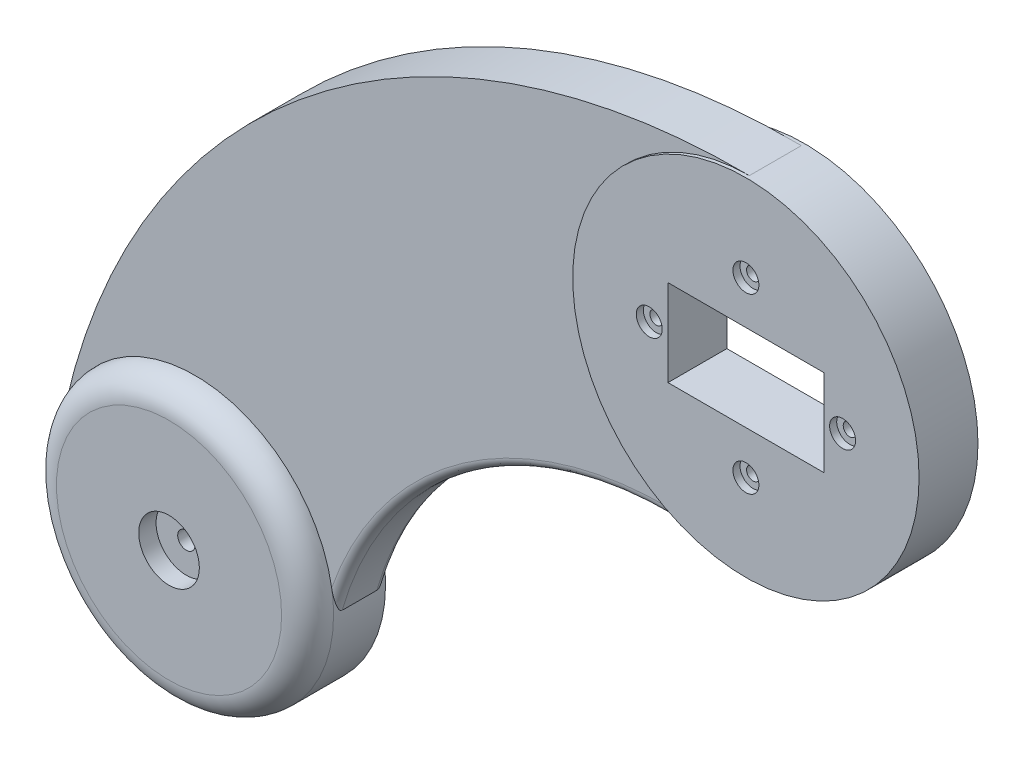
from build123d import *

# Parameters (mm, degrees)
BOSS_EXTRUDE3_DEPTH                                 = 3.81
BOSS_EXTRUDE4_DEPTH                                 = 7.62
BOSS_EXTRUDE4_DEPTH_BACK                            = 3.81
SKETCH1_6_R                                         = 20.32
SKETCH1_7_R                                         = 25.4
BOSS_EXTRUDE5_DEPTH                                 = 4.318
SKETCH3_R                                           = 1.27
CUT_EXTRUDE1_DEPTH                                  = 11.43
SKETCH4_R                                           = 4.445
CUT_EXTRUDE2_DEPTH                                  = 2.54
FILLET1_R                                           = 3.81
SKETCH5_R                                           = 19.05
CUT_EXTRUDE3_DEPTH                                  = 6.35
SKETCH6_W                                           = 22.86
SKETCH6_H                                           = 12.7
CUT_EXTRUDE4_DEPTH                                  = 138.528436683
FILLET8_R                                           = 1.27
FILLET9_R                                           = 1.27
CBORE_FOR_1_BINDING_HEAD_MACHINE_SCREW3_D           = 1.89992
CBORE_FOR_1_BINDING_HEAD_MACHINE_SCREW3_DEPTH       = 5.017206446
CBORE_FOR_1_BINDING_HEAD_MACHINE_SCREW3_CBORE_D     = 3.81
CBORE_FOR_1_BINDING_HEAD_MACHINE_SCREW3_CBORE_DEPTH = 1.0414
CBORE_FOR_1_BINDING_HEAD_MACHINE_SCREW3_TIP         = 0.570793554
BOSS_EXTRUDE6_START                                 = 2.54
SKETCH17_R                                          = 19.05
BOSS_EXTRUDE6_DEPTH                                 = 2.54


# Read off the part's stored shape, not the designer's step: CBORE for #1 Binding Head Machine Screw4
# Some blends are built 0.0001 mm under size
with BuildPart() as part:
    # Sketch1 → Boss-Extrude3 (new, symmetric)
    with BuildSketch(Plane.XY):
        with BuildLine():
            ThreePointArc((-18.897418568, 7.46926847), (3.801766346, 19.961186654), (20.32, 0))
            ThreePointArc((20.32, 0), (40.208637995, 27.902434348), (73.290830481, 36.828368704))
            ThreePointArc((73.290830481, 36.828368704), (56.22683941, 64.989379592), (81.300738581, 86.332338755))
            ThreePointArc((81.300738581, 86.332338755), (17.289703956, 64.576407081), (-18.897418568, 7.46926847))
        make_face()
    extrude(amount=BOSS_EXTRUDE3_DEPTH, both=True)

    # Sketch1<6> → Boss-Extrude4 (add, two sides: drawn at the far end of the back side and taken through both)
    with BuildSketch(Plane.XY.offset(-BOSS_EXTRUDE4_DEPTH_BACK)):
        Circle(SKETCH1_6_R)
    extrude(amount=BOSS_EXTRUDE4_DEPTH + BOSS_EXTRUDE4_DEPTH_BACK)

    # Sketch1<7> → Boss-Extrude5 (add, symmetric)
    with BuildSketch(Plane.XY):
        with Locations((81.300738581, 60.932338755)):
            Circle(SKETCH1_7_R)
    extrude(amount=BOSS_EXTRUDE5_DEPTH, both=True)

    # Sketch3 → Cut-Extrude1 (cut)
    with BuildSketch(Plane(origin=(0, 0, -3.81), x_dir=(-1, 0, 0), z_dir=(0, 0, -1))):
        Circle(SKETCH3_R)
    extrude(amount=-CUT_EXTRUDE1_DEPTH, mode=Mode.SUBTRACT)

    # Sketch4 → Cut-Extrude2 (cut)
    with BuildSketch(Plane.XY.offset(7.62)):
        Circle(SKETCH4_R)
    extrude(amount=-CUT_EXTRUDE2_DEPTH, mode=Mode.SUBTRACT)

    # Fillet1
    fillet1_edges = [part.edges().sort_by_distance(p)[0] for p in [
        (-20.32, 0, 7.62),
    ]]
    fillet(fillet1_edges, radius=FILLET1_R - 0.0001)  # a hair under: the kernel refuses the full size

    # Sketch5 → Cut-Extrude3 (cut)
    with BuildSketch(Plane(origin=(0, 0, -3.81), x_dir=(-1, 0, 0), z_dir=(0, 0, -1))):
        Circle(SKETCH5_R)
    extrude(amount=-CUT_EXTRUDE3_DEPTH, mode=Mode.SUBTRACT)

    # Sketch6 → Cut-Extrude4 (cut, through all)
    with BuildSketch(Plane.XY.offset(4.318)):
        with Locations((81.300738581, 60.932338755)):
            Rectangle(SKETCH6_W, SKETCH6_H)
    extrude(amount=-CUT_EXTRUDE4_DEPTH, mode=Mode.SUBTRACT)

    # Fillet8
    # the kernel refuses this fillet: 1.27 mm, written as the material it takes off along each edge
    with BuildSketch(Plane(origin=(69.207620463, -13.807264954, 3.81), x_dir=(-0.9774560412595347, 0.21113902388056724, 0), z_dir=(-0.21113902388056724, -0.9774560412595347, 0))) as fillet8_piece_1_section:
        with BuildLine():
            CenterArc((50.8 + FILLET8_R, FILLET8_R), FILLET8_R, 180, 90)
            Line((50.8, FILLET8_R), (50.8, 0))
            Line((50.8, 0), (50.8 + FILLET8_R, 0))
        make_face()
    fillet8_piece_1 = revolve(axis=Axis((69.207620463, -13.807264954, 3.81), (0, 0, -1)), revolution_arc=86.003281832, mode=Mode.PRIVATE)
    fillet8_piece_1 = fillet8_piece_1 - Plane(origin=(0, 0, 3.45954073), x_dir=(1, 0, 0), z_dir=(0, 0, -1)) * Cylinder(20.32, 209, mode=Mode.PRIVATE)
    fillet8_piece_1 = fillet8_piece_1 - Plane(origin=(81.300738581, 60.932338755, 3.45954073), x_dir=(1, 0, 0), z_dir=(0, 0, 1)) * Cylinder(25.4, 209, mode=Mode.PRIVATE)
    add(fillet8_piece_1, mode=Mode.SUBTRACT)
    with BuildSketch(Plane(origin=(69.207620463, -13.807264954, -3.81), x_dir=(-0.9774560412595347, 0.21113902388056724, 0), z_dir=(-0.21113902388056724, -0.9774560412595347, 0))) as fillet8_piece_2_section:
        with BuildLine():
            CenterArc((50.8 + FILLET8_R, -FILLET8_R), FILLET8_R, 90, 90)
            Line((50.8 + FILLET8_R, 0), (50.8, 0))
            Line((50.8, 0), (50.8, -FILLET8_R))
        make_face()
    fillet8_piece_2 = revolve(axis=Axis((69.207620463, -13.807264954, -3.81), (0, 0, -1)), revolution_arc=86.003281832, mode=Mode.PRIVATE)
    fillet8_piece_2 = fillet8_piece_2 - Plane(origin=(0, 0, -3.459540406), x_dir=(1, 0, 0), z_dir=(0, 0, -1)) * Cylinder(20.32, 209, mode=Mode.PRIVATE)
    fillet8_piece_2 = fillet8_piece_2 - Plane(origin=(81.300738581, 60.932338755, -3.459540406), x_dir=(1, 0, 0), z_dir=(0, 0, 1)) * Cylinder(25.4, 209, mode=Mode.PRIVATE)
    add(fillet8_piece_2, mode=Mode.SUBTRACT)

    # Fillet9
    fillet9_edges = [part.edges().sort_by_distance(p)[0] for p in [
        (19.05, 0, -3.81),
    ]]
    fillet(fillet9_edges, radius=FILLET9_R - 0.0001)  # a hair under: the kernel refuses the full size

    # CBORE for #1 Binding Head Machine Screw3
    with Locations(Plane.XY.offset(4.318)):
        with Locations((81.300738581, 73.632338755), (81.300738581, 48.232338755)):
            CounterBoreHole(CBORE_FOR_1_BINDING_HEAD_MACHINE_SCREW3_D / 2, CBORE_FOR_1_BINDING_HEAD_MACHINE_SCREW3_CBORE_D / 2, CBORE_FOR_1_BINDING_HEAD_MACHINE_SCREW3_CBORE_DEPTH, depth=CBORE_FOR_1_BINDING_HEAD_MACHINE_SCREW3_DEPTH)
            with Locations((0, 0, -(CBORE_FOR_1_BINDING_HEAD_MACHINE_SCREW3_DEPTH + CBORE_FOR_1_BINDING_HEAD_MACHINE_SCREW3_TIP / 2))):  # 118° drill point
                Cone(0, CBORE_FOR_1_BINDING_HEAD_MACHINE_SCREW3_D / 2, CBORE_FOR_1_BINDING_HEAD_MACHINE_SCREW3_TIP, mode=Mode.SUBTRACT)

    # Sketch17 → Boss-Extrude6 (add)
    with BuildSketch(Plane(origin=(0, 0, 2.54), x_dir=(-1, 0, 0), z_dir=(0, 0, -1)).offset(BOSS_EXTRUDE6_START)):
        Circle(SKETCH17_R)
        with BuildLine():
            ThreePointArc((0.774129568, -3.470714539), (0.389406663, -3.534614328), (0, -3.556))
            ThreePointArc((0, -3.556), (-0.389406663, -3.534614328), (-0.774129568, -3.470714539))
            Line((-0.774129568, -3.470714539), (-14.986, -1.905))
            ThreePointArc((-14.986, -1.905), (-16.891, 0), (-14.986, 1.905))
            Line((-14.986, 1.905), (-0.774129568, 3.470714539))
            ThreePointArc((-0.774129568, 3.470714539), (-0.389406663, 3.534614328), (0, 3.556))
            ThreePointArc((0, 3.556), (0.389406663, 3.534614328), (0.774129568, 3.470714539))
            Line((0.774129568, 3.470714539), (14.986, 1.905))
            ThreePointArc((14.986, 1.905), (16.333038418, 1.347038418), (16.891, 0))
            ThreePointArc((16.891, 0), (16.333038418, -1.347038418), (14.986, -1.905))
            Line((14.986, -1.905), (0.774129568, -3.470714539))
        make_face(mode=Mode.SUBTRACT)
    extrude(amount=-BOSS_EXTRUDE6_DEPTH)

    # CBORE for _1 Binding Head Machine Sc 2 → CBORE for #1 Binding Head Machine Screw4 (revolve, cut)
    with BuildSketch(Plane(origin=(95.480738581, 60.932338755, 0), x_dir=(1, 0, 0), z_dir=(0, -1, 0))):
        Polygon((1.905, 4.318), (0, 4.318), (0, -1.27), (0.94996, -0.699206446), (0.94996, 3.2766), (1.905, 3.2766), align=None)
    revolve(axis=Axis((95.480738581, 60.932338755, 0), (0, 0, 1)), mode=Mode.SUBTRACT)

    # CBORE for _1 Binding Head Machine Sc 3 o → CBORE for _1 Binding Head Machine Sc 3 (revolve, cut)
    with BuildSketch(Plane(origin=(67.120738581, 60.932338755, 0), x_dir=(1, 0, 0), z_dir=(0, -1, 0))):
        Polygon((1.905, 4.318), (0, 4.318), (0, -1.27), (0.94996, -0.699206446), (0.94996, 3.2766), (1.905, 3.2766), align=None)
    revolve(axis=Axis((67.120738581, 60.932338755, 0), (0, 0, 1)), mode=Mode.SUBTRACT)


solid = part.part
